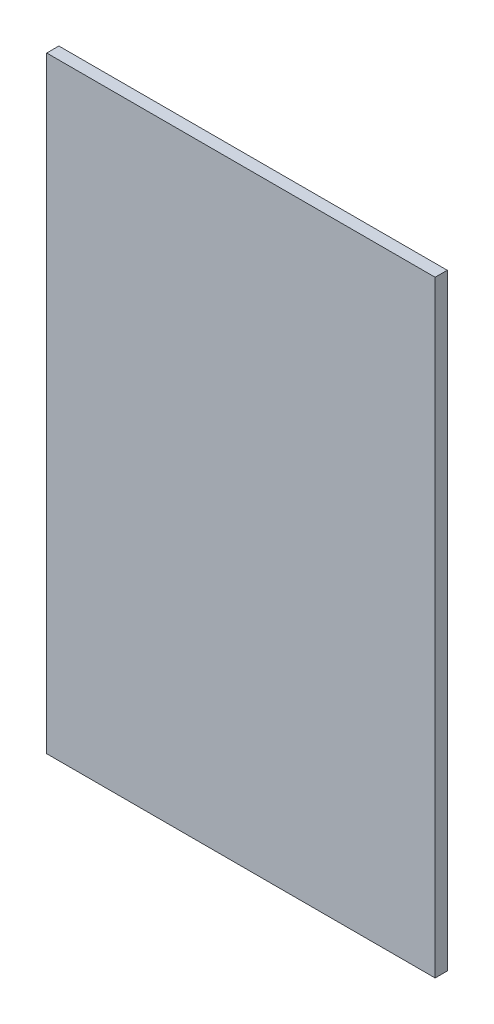
from build123d import *

# Parameters (mm, degrees)
SKETCH1_W           = 203.2
SKETCH1_H           = 317.5
BOSS_EXTRUDE1_DEPTH = 6.35


with BuildPart() as part:
    # Sketch1 → Boss-Extrude1 (new body)
    with BuildSketch(Plane.XY):
        with Locations((-101.6, 158.75)):
            Rectangle(SKETCH1_W, SKETCH1_H)
    extrude(amount=BOSS_EXTRUDE1_DEPTH)


solid = part.part
